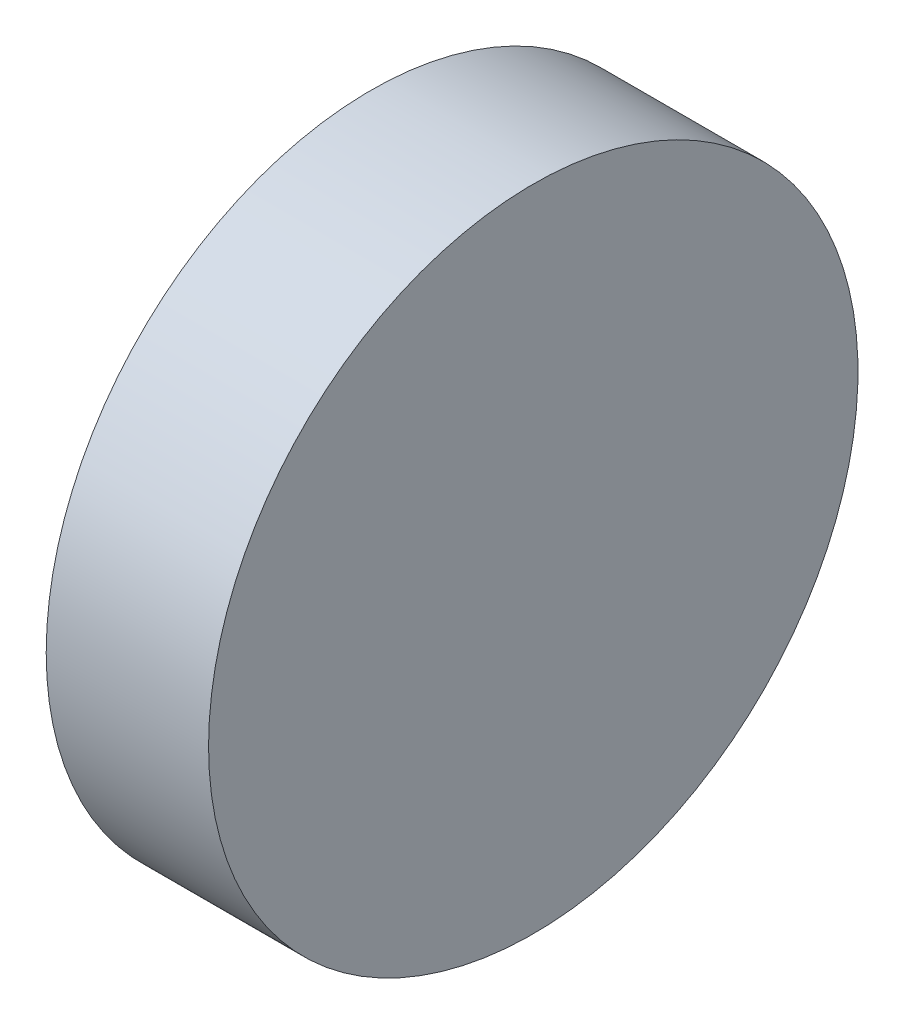
from build123d import *

# Parameters (mm, degrees)
SKETCH1_R           = 9.525
BOSS_EXTRUDE1_DEPTH = 4.7625


with BuildPart() as part:
    # Sketch1 → Boss-Extrude1 (new body)
    with BuildSketch(Plane(origin=(0, 0, 0), x_dir=(0, 0, -1), z_dir=(1, 0, 0))):
        Circle(SKETCH1_R)
    extrude(amount=BOSS_EXTRUDE1_DEPTH)


solid = part.part
